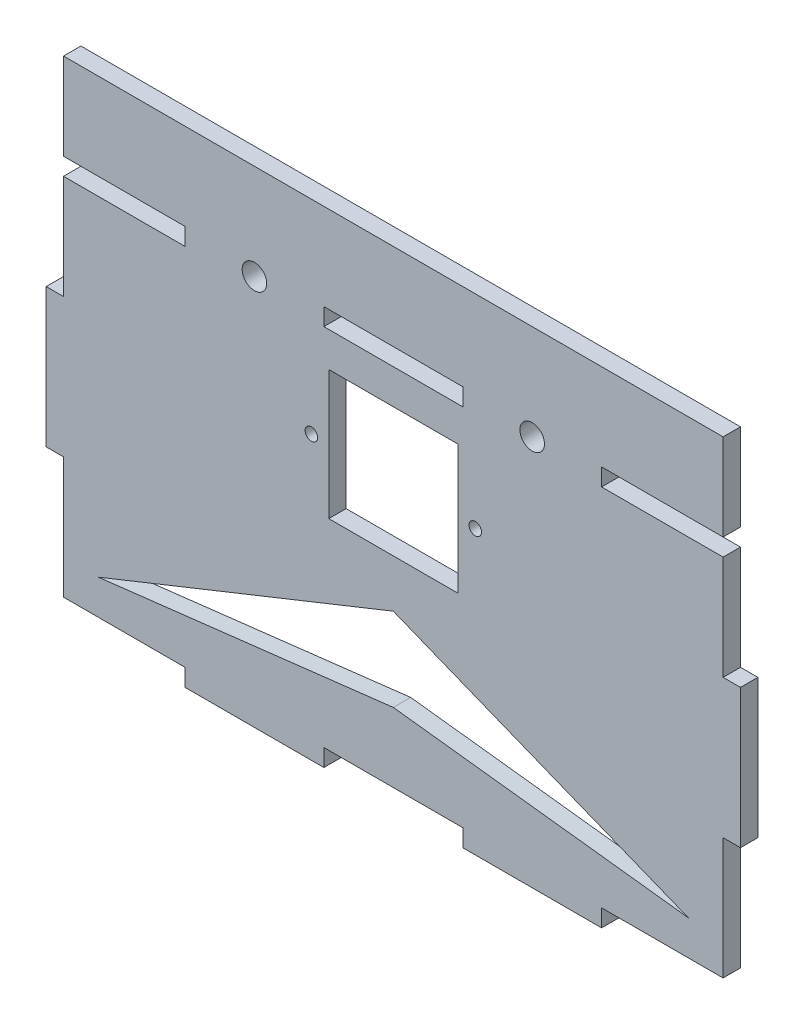
from build123d import *

# Parameters (mm, degrees)
SKETCH1_W                 = 127
SKETCH1_H                 = 88.9
BOSS_EXTRUDE1_DEPTH       = 3.175
SKETCH5_W                 = 3.175
SKETCH5_H                 = 25.4
CUT_EXTRUDE4_DEPTH        = 6.35
SKETCH6_W                 = 25.4
SKETCH6_H                 = 3.175
CUT_EXTRUDE5_DEPTH        = 6.35
LPATTERN5_COUNT           = 3
LPATTERN5_PITCH           = 50.8
LPATTERN5_COUNT_DIR2      = 2
LPATTERN5_PITCH_DIR2      = 123.825
LPATTERN6_COUNT           = 3
LPATTERN6_PITCH           = 50.8
LPATTERN6_COUNT_DIR2      = 2
LPATTERN6_PITCH_DIR2      = 69.85
F_8_CLEARANCE_HOLE1_D     = 4.4958
F_8_CLEARANCE_HOLE1_DEPTH = 10.16
F_8_CLEARANCE_HOLE1_TIP   = 1.350674586
SKETCH11_R                = 1.143
SKETCH11_W                = 23.622
SKETCH11_H                = 23.622
CUT_EXTRUDE8_DEPTH        = 7.62
CUT_EXTRUDE11_DEPTH       = 12.7
SKETCH16_W                = 3.175
SKETCH16_H                = 12.7
CUT_EXTRUDE13_DEPTH       = 5.08


with BuildPart() as part:
    # Sketch1 → Boss-Extrude1 (new body)
    with BuildSketch(Plane.XY):
        with Locations((63.5, 44.45)):
            Rectangle(SKETCH1_W, SKETCH1_H)
    extrude(amount=BOSS_EXTRUDE1_DEPTH)

    # Sketch5 → Cut-Extrude4 (cut)
    with BuildSketch(Plane.XY.offset(3.175)):
        with Locations((1.5875, 12.7)):
            Rectangle(SKETCH5_W, SKETCH5_H)
    cut_extrude4 = extrude(amount=-CUT_EXTRUDE4_DEPTH, mode=Mode.SUBTRACT)

    # Sketch6 → Cut-Extrude5 (cut)
    with BuildSketch(Plane.XY.offset(3.175)):
        with Locations((12.7, 1.5875)):
            Rectangle(SKETCH6_W, SKETCH6_H)
    cut_extrude5 = extrude(amount=-CUT_EXTRUDE5_DEPTH, mode=Mode.SUBTRACT)

    # LPattern5: Cut-Extrude4 3 × 2
    with Locations(*[(j * LPATTERN5_PITCH_DIR2, i * LPATTERN5_PITCH, 0) for i in range(LPATTERN5_COUNT) for j in range(LPATTERN5_COUNT_DIR2) if (i, j) != (0, 0)]):
        add(cut_extrude4, mode=Mode.SUBTRACT)

    # LPattern6: Cut-Extrude5 3 × 2
    with Locations(*[(i * LPATTERN6_PITCH, j * LPATTERN6_PITCH_DIR2, 0) for i in range(LPATTERN6_COUNT) for j in range(LPATTERN6_COUNT_DIR2) if (i, j) != (0, 0)]):
        add(cut_extrude5, mode=Mode.SUBTRACT)

    # #8 Clearance Hole1
    with Locations(Plane.XY.offset(3.175)):
        with Locations((38.1, 71.4375), (88.9, 71.4375)):
            Hole(F_8_CLEARANCE_HOLE1_D / 2, depth=F_8_CLEARANCE_HOLE1_DEPTH)
            with Locations((0, 0, -(F_8_CLEARANCE_HOLE1_DEPTH + F_8_CLEARANCE_HOLE1_TIP / 2))):  # 118° drill point
                Cone(0, F_8_CLEARANCE_HOLE1_D / 2, F_8_CLEARANCE_HOLE1_TIP, mode=Mode.SUBTRACT)

    # Sketch11 → Cut-Extrude8 (cut)
    with BuildSketch(Plane.XY.offset(3.175)):
        with Locations((48.514, 51.689)):
            Circle(SKETCH11_R)
        with Locations((78.486, 51.689)):
            Circle(SKETCH11_R)
        with Locations((63.5, 51.689)):
            Rectangle(SKETCH11_W, SKETCH11_H)
    extrude(amount=-CUT_EXTRUDE8_DEPTH, mode=Mode.SUBTRACT)

    # Sketch14 → Cut-Extrude11 (cut)
    with BuildSketch(Plane(origin=(0, 0, 0), x_dir=(-1, 0, 0), z_dir=(0, 0, -1))):
        Polygon((-117.475, 9.525), (-63.5, 31.115), (-9.525, 9.525), (-63.5, 15.875), align=None)
    extrude(amount=-CUT_EXTRUDE11_DEPTH, mode=Mode.SUBTRACT)

    # Sketch16 → Cut-Extrude13 (cut)
    with BuildSketch(Plane(origin=(0, 0, 0), x_dir=(-1, 0, 0), z_dir=(0, 0, -1))):
        with Locations((-125.4125, 82.55)):
            Rectangle(SKETCH16_W, SKETCH16_H)
        with Locations((-1.5875, 82.55)):
            Rectangle(SKETCH16_W, SKETCH16_H)
    extrude(amount=-CUT_EXTRUDE13_DEPTH, mode=Mode.SUBTRACT)


solid = part.part
